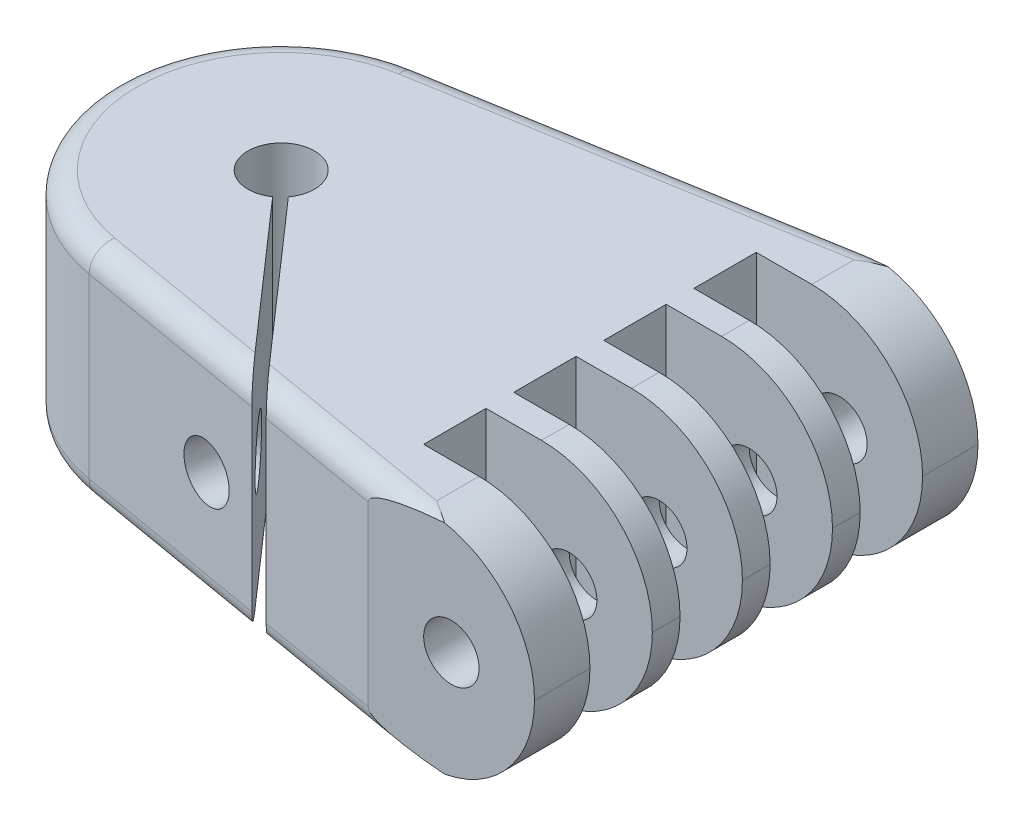
from build123d import *

# Parameters (mm, degrees)
BOSS_EXTRUDE1_DEPTH = 20
FILLET1_R           = 10
SKETCH2_R           = 2.5
CUT_EXTRUDE1_DEPTH  = 40
FILLET2_R           = 2
SKETCH3_R           = 2.5
CUT_EXTRUDE2_DEPTH  = 10
SKETCH4_R           = 10
SKETCH4_R_2         = 3
BOSS_EXTRUDE2_DEPTH = 20
CUT_EXTRUDE3_DEPTH  = 52.342938219


# Some blends are built 0.0001 mm under size
with BuildPart() as part:
    # Sketch1 → Boss-Extrude1 (new body)
    with BuildSketch(Plane(origin=(0, 0, 0), x_dir=(1, 0, 0), z_dir=(0, 1, 0))):
        with BuildLine():
            Line((27.849705815, 9.375), (27.849705815, 15))
            Line((27.849705815, 15), (42.849705815, 15))
            Line((42.849705815, 15), (42.849705815, 20))
            Line((42.849705815, 20), (27.849705815, 20))
            Line((27.849705815, 20), (-2.537743238, 14.78377013))
            ThreePointArc((-2.537743238, 14.78377013), (-15, 0), (-2.537743238, -14.78377013))
            Line((-2.537743238, -14.78377013), (15.176440556, -17.824540498))
            Line((15.176440556, -17.824540498), (6.327966589, -7.743180151))
            ThreePointArc((6.327966589, -7.743180151), (-6.707251498, 7.417059885), (7.069754095, -7.072381285))
            Line((7.069754095, -7.072381285), (16.743020962, -18.093455585))
            Line((16.743020962, -18.093455585), (27.849705815, -20))
            Line((27.849705815, -20), (42.849705815, -20))
            Line((42.849705815, -20), (42.849705815, -15))
            Line((42.849705815, -15), (27.849705815, -15))
            Line((27.849705815, -15), (27.849705815, -9.375))
            Line((27.849705815, -9.375), (42.849705815, -9.375))
            Line((42.849705815, -9.375), (42.849705815, -6.875))
            Line((42.849705815, -6.875), (27.849705815, -6.875))
            Line((27.849705815, -6.875), (27.849705815, -1.25))
            Line((27.849705815, -1.25), (42.849705815, -1.25))
            Line((42.849705815, -1.25), (42.849705815, 1.25))
            Line((42.849705815, 1.25), (27.849705815, 1.25))
            Line((27.849705815, 1.25), (27.849705815, 6.875))
            Line((27.849705815, 6.875), (42.849705815, 6.875))
            Line((42.849705815, 6.875), (42.849705815, 9.375))
            Line((42.849705815, 9.375), (27.849705815, 9.375))
        make_face()
    extrude(amount=BOSS_EXTRUDE1_DEPTH)

    # Fillet1
    fillet1_edges = [part.edges().sort_by_distance(p)[0] for p in [
        (42.849705815, 0, 17.5),
        (42.849705815, 0, 8.125),
        (42.849705815, 0, 0),
        (42.849705815, 0, -8.125),
        (42.849705815, 0, -17.5),
        (42.849705815, 20, -17.5),
        (42.849705815, 20, -8.125),
        (42.849705815, 20, 0),
        (42.849705815, 20, 8.125),
        (42.849705815, 20, 17.5),
    ]]
    fillet(fillet1_edges, radius=FILLET1_R - 0.0001)  # a hair under: the kernel refuses the full size

    # Sketch2 → Cut-Extrude1 (cut)
    with BuildSketch(Plane(origin=(0, 0, -20), x_dir=(-1, 0, 0), z_dir=(0, 0, -1))):
        with Locations((-35.349705815, 10)):
            Circle(SKETCH2_R)
    extrude(amount=-CUT_EXTRUDE1_DEPTH, mode=Mode.SUBTRACT)

    # Fillet2
    # the kernel refuses this fillet: 2 mm, written as the material it takes off along each edge
    with BuildSketch(Plane(origin=(39.676721919, 0, -22.03019459), x_dir=(0.16918288251037936, 0, 0.9855846753402162), z_dir=(-0.9855846753402161, 0, 0.16918288251037933))) as fillet2_piece_1:
        with BuildLine():
            CenterArc((FILLET2_R, FILLET2_R), FILLET2_R, 180, 90)
            Line((0, FILLET2_R), (-FILLET2_R * 0.02, FILLET2_R))
            Line((-FILLET2_R * 0.02, FILLET2_R), (-FILLET2_R * 0.02, -FILLET2_R * 0.02))
            Line((-FILLET2_R * 0.02, -FILLET2_R * 0.02), (FILLET2_R, -FILLET2_R * 0.02))
            Line((FILLET2_R, -FILLET2_R * 0.02), (FILLET2_R, 0))
        make_face()
    extrude(amount=42.831900914, mode=Mode.SUBTRACT)
    with BuildSketch(Plane(origin=(-2.537743238, 0, 14.78377013), x_dir=(0.16918288251037944, 0, -0.9855846753402161), z_dir=(0.9855846753402161, 0, 0.16918288251037944))) as fillet2_piece_2:
        with BuildLine():
            CenterArc((FILLET2_R, FILLET2_R), FILLET2_R, 180, 90)
            Line((0, FILLET2_R), (-FILLET2_R * 0.02, FILLET2_R))
            Line((-FILLET2_R * 0.02, FILLET2_R), (-FILLET2_R * 0.02, -FILLET2_R * 0.02))
            Line((-FILLET2_R * 0.02, -FILLET2_R * 0.02), (FILLET2_R, -FILLET2_R * 0.02))
            Line((FILLET2_R, -FILLET2_R * 0.02), (FILLET2_R, 0))
        make_face()
    extrude(amount=29.973274379, mode=Mode.SUBTRACT)
    with BuildSketch(Plane(origin=(39.676721919, 20, -22.03019459), x_dir=(0.16918288251037936, 0, 0.9855846753402162), z_dir=(-0.9855846753402161, 0, 0.16918288251037933))) as fillet2_piece_3:
        with BuildLine():
            CenterArc((FILLET2_R, -FILLET2_R), FILLET2_R, 90, 90)
            Line((0, -FILLET2_R), (-FILLET2_R * 0.02, -FILLET2_R))
            Line((-FILLET2_R * 0.02, -FILLET2_R), (-FILLET2_R * 0.02, FILLET2_R * 0.02))
            Line((-FILLET2_R * 0.02, FILLET2_R * 0.02), (FILLET2_R, FILLET2_R * 0.02))
            Line((FILLET2_R, FILLET2_R * 0.02), (FILLET2_R, 0))
        make_face()
    extrude(amount=42.831900914, mode=Mode.SUBTRACT)
    with BuildSketch(Plane(origin=(-2.537743238, 20, 14.78377013), x_dir=(0.16918288251037944, 0, -0.9855846753402161), z_dir=(0.9855846753402161, 0, 0.16918288251037944))) as fillet2_piece_4:
        with BuildLine():
            CenterArc((FILLET2_R, -FILLET2_R), FILLET2_R, 90, 90)
            Line((0, -FILLET2_R), (-FILLET2_R * 0.02, -FILLET2_R))
            Line((-FILLET2_R * 0.02, -FILLET2_R), (-FILLET2_R * 0.02, FILLET2_R * 0.02))
            Line((-FILLET2_R * 0.02, FILLET2_R * 0.02), (FILLET2_R, FILLET2_R * 0.02))
            Line((FILLET2_R, FILLET2_R * 0.02), (FILLET2_R, 0))
        make_face()
    extrude(amount=29.973274379, mode=Mode.SUBTRACT)
    with BuildSketch(Plane(origin=(4.916004858, 0, 16.063260995), x_dir=(0.16918288251037944, 0, -0.9855846753402161), z_dir=(0.9855846753402161, 0, 0.16918288251037944))) as fillet2_piece_5:
        with BuildLine():
            CenterArc((FILLET2_R, FILLET2_R), FILLET2_R, 180, 90)
            Line((0, FILLET2_R), (-FILLET2_R * 0.02, FILLET2_R))
            Line((-FILLET2_R * 0.02, FILLET2_R), (-FILLET2_R * 0.02, -FILLET2_R * 0.02))
            Line((-FILLET2_R * 0.02, -FILLET2_R * 0.02), (FILLET2_R, -FILLET2_R * 0.02))
            Line((FILLET2_R, -FILLET2_R * 0.02), (FILLET2_R, 0))
        make_face()
    extrude(amount=35.269133064, mode=Mode.SUBTRACT)
    with BuildSketch(Plane(origin=(4.916004858, 20, 16.063260995), x_dir=(0.16918288251037944, 0, -0.9855846753402161), z_dir=(0.9855846753402161, 0, 0.16918288251037944))) as fillet2_piece_6:
        with BuildLine():
            CenterArc((FILLET2_R, -FILLET2_R), FILLET2_R, 90, 90)
            Line((0, -FILLET2_R), (-FILLET2_R * 0.02, -FILLET2_R))
            Line((-FILLET2_R * 0.02, -FILLET2_R), (-FILLET2_R * 0.02, FILLET2_R * 0.02))
            Line((-FILLET2_R * 0.02, FILLET2_R * 0.02), (FILLET2_R, FILLET2_R * 0.02))
            Line((FILLET2_R, FILLET2_R * 0.02), (FILLET2_R, 0))
        make_face()
    extrude(amount=35.269133064, mode=Mode.SUBTRACT)
    with BuildSketch(Plane(origin=(0, 0, 0), x_dir=(-0.16918288251037905, 0, -0.9855846753402162), z_dir=(0.9855846753402162, 0, -0.16918288251037905))) as fillet2_piece_7:
        with BuildLine():
            CenterArc((15 - FILLET2_R, FILLET2_R), FILLET2_R, 270, 90)
            Line((15, FILLET2_R), (15 + FILLET2_R * 0.02, FILLET2_R))
            Line((15 + FILLET2_R * 0.02, FILLET2_R), (15 + FILLET2_R * 0.02, -FILLET2_R * 0.02))
            Line((15 + FILLET2_R * 0.02, -FILLET2_R * 0.02), (15 - FILLET2_R, -FILLET2_R * 0.02))
            Line((15 - FILLET2_R, -FILLET2_R * 0.02), (15 - FILLET2_R, 0))
        make_face()
    revolve(axis=Axis((0, 0, 0), (0, 1, 0)), revolution_arc=160.519372943, mode=Mode.SUBTRACT)
    with BuildSketch(Plane(origin=(0, 20, 0), x_dir=(-0.16918288251037905, 0, -0.9855846753402162), z_dir=(0.9855846753402162, 0, -0.16918288251037905))) as fillet2_piece_8:
        with BuildLine():
            CenterArc((15 - FILLET2_R, -FILLET2_R), FILLET2_R, 0, 90)
            Line((15, -FILLET2_R), (15 + FILLET2_R * 0.02, -FILLET2_R))
            Line((15 + FILLET2_R * 0.02, -FILLET2_R), (15 + FILLET2_R * 0.02, FILLET2_R * 0.02))
            Line((15 + FILLET2_R * 0.02, FILLET2_R * 0.02), (15 - FILLET2_R, FILLET2_R * 0.02))
            Line((15 - FILLET2_R, FILLET2_R * 0.02), (15 - FILLET2_R, 0))
        make_face()
    revolve(axis=Axis((0, 20, 0), (0, 1, 0)), revolution_arc=160.519372943, mode=Mode.SUBTRACT)

    # Sketch3 → Cut-Extrude2 (cut)
    with BuildSketch(Plane(origin=(-2.537743238, 0, 14.78377013), x_dir=(0.9855846753402161, 0, 0.16918288251037955), z_dir=(-0.16918288251037955, 0, 0.9855846753402161))):
        with Locations((12.973274379, 10)):
            Circle(SKETCH3_R)
    extrude(amount=-CUT_EXTRUDE2_DEPTH, mode=Mode.SUBTRACT)

    # Sketch4 → Boss-Extrude2 (add)
    with BuildSketch(Plane.XZ):
        Circle(SKETCH4_R)
        with Locations(Location((0, 0, 0), (0, 0, 270))):
            Circle(SKETCH4_R_2, mode=Mode.SUBTRACT)
    extrude(amount=-BOSS_EXTRUDE2_DEPTH)

    # Sketch6 → Cut-Extrude3 (cut, through all)
    with BuildSketch(Plane.XZ):
        with BuildLine():
            ThreePointArc((7.069754095, 7.072381285), (6.707251498, 7.417059885), (6.327966589, 7.743180151))
            Line((6.327966589, 7.743180151), (1.700797535, 2.471292727))
            ThreePointArc((1.700797535, 2.471292727), (2.089347904, 2.152817999), (2.419304242, 1.773969274))
            Line((2.419304242, 1.773969274), (7.069754095, 7.072381285))
        make_face()
    extrude(amount=-CUT_EXTRUDE3_DEPTH, mode=Mode.SUBTRACT)


solid = part.part
